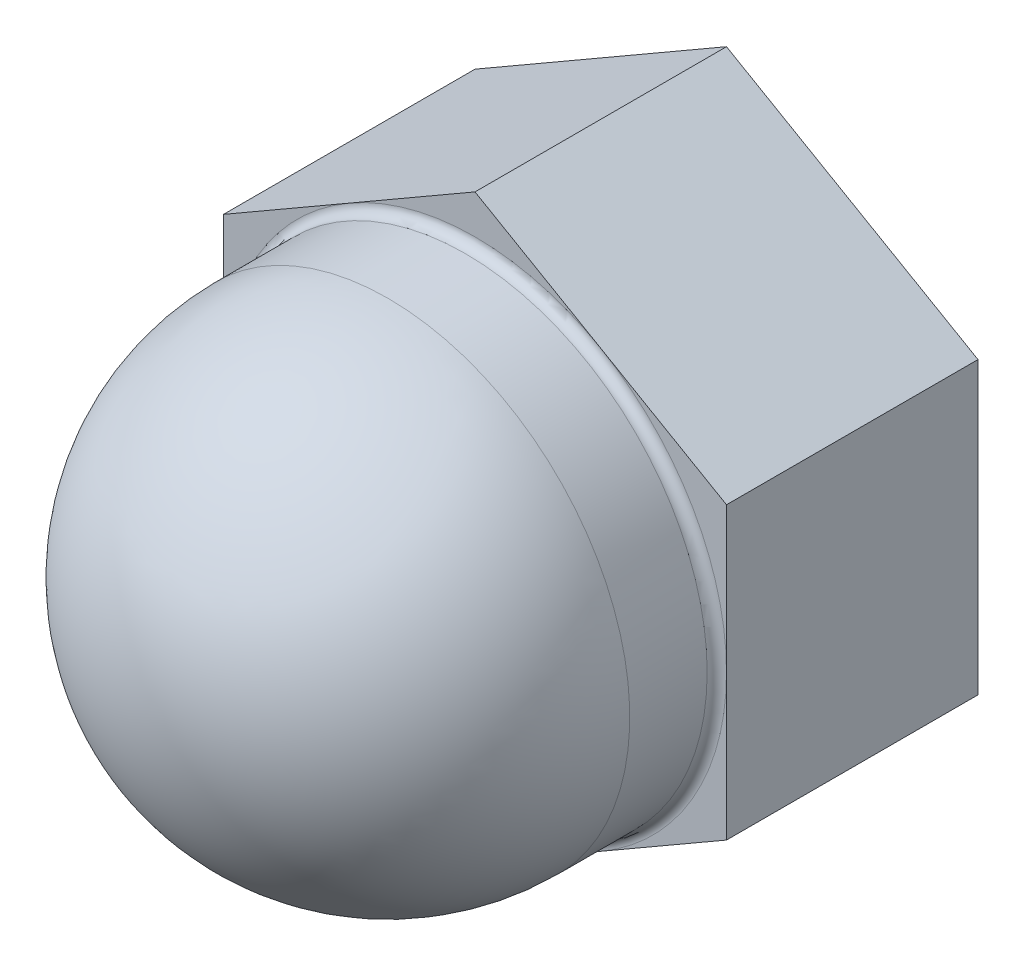
from build123d import *

# Parameters (mm, degrees)
EXTRUDE_1_DEPTH     = 3.25
FILLET_1_R          = 0.25
SKETCH_4_R          = 4
CUT_EXTRUDE_1_DEPTH = 10.65
THREAD_1_PITCH      = 1.25


with BuildPart() as part:
    # Эскиз2 → Бобышка-Вытянуть1 (new, symmetric)
    with BuildSketch(Plane.XY):
        Polygon((0, 7.505553499), (-6.5, 3.75277675), (-6.5, -3.75277675), (0, -7.505553499), (6.5, -3.75277675), (6.5, 3.75277675), align=None)
    extrude(amount=EXTRUDE_1_DEPTH, both=True)

    # Эскиз3 → Повернуть1 (revolve)
    with BuildSketch(Plane(origin=(0, 0, 0), x_dir=(0, 0, -1), z_dir=(1, 0, 0))):
        with BuildLine():
            Line((-3.25, 0), (-11.75, 0))
            ThreePointArc((-11.75, 0), (-9.919417382, 4.419417382), (-5.5, 6.25))
            Line((-5.5, 6.25), (-3.25, 6.25))
            Line((-3.25, 6.25), (-3.25, 0))
        make_face()
    revolve(axis=Axis((0, 0, 3.25), (0, 0, 1)))

    # Скругление1
    fillet_1_edges = [part.edges().sort_by_distance(p)[0] for p in [
        (0, -6.25, 3.25),
    ]]
    fillet(fillet_1_edges, radius=FILLET_1_R - 0.0001)  # a hair under: the kernel refuses the full size

    # Эскиз4 → Вырез-Вытянуть1 (cut)
    with BuildSketch(Plane(origin=(0, 0, -3.25), x_dir=(-1, 0, 0), z_dir=(0, 0, -1))):
        Circle(SKETCH_4_R)
    extrude(amount=-CUT_EXTRUDE_1_DEPTH, mode=Mode.SUBTRACT)

    # Резьба1: the profile of Профиль резьбы1 profile screwed along a right-hand helix of 8.52 turns, 8 arcs to a turn; built about Z, then put on its axis
    thread_1_z = Axis((0, 0, 0), (0, 0, 1))
    thread_1_corners = [(4.0003, 0, -0.000173205), (3.323417656, 0, 0.390624998), (3.323417656, 0, 0.546874998), (4.0003, 0, 0.937673202)]
    with BuildLine(mode=Mode.PRIVATE) as thread_1_profile:
        Line(thread_1_corners[0], thread_1_corners[1])
        Line(thread_1_corners[1], thread_1_corners[2])
        Line(thread_1_corners[2], thread_1_corners[3])
        Line(thread_1_corners[3], thread_1_corners[0])
    thread_1_cap = Face(thread_1_profile.wire())
    thread_1_turn_angles = [0, 22.5, 45, 67.5, 90, 112.5, 135, 157.5, 180, 202.5, 225, 247.5, 270, 292.5, 315, 337.5, 360]
    thread_1_turn_weights = [1, 0.9238795325112867, 1, 0.9238795325112867, 1, 0.9238795325112867, 1, 0.9238795325112867, 1, 0.9238795325112867, 1, 0.9238795325112867, 1, 0.9238795325112867, 1, 0.9238795325112867, 1]
    thread_1_turn_rails = [Edge.make_bspline([Vector(p[0], p[1], 0).rotate(thread_1_z, thread_1_turn_angles[k]) / thread_1_turn_weights[k] + Vector(0, 0, p[2] + THREAD_1_PITCH * thread_1_turn_angles[k] / 360) for k in range(17)], [0, 0, 0, 1, 1, 2, 2, 3, 3, 4, 4, 5, 5, 6, 6, 7, 7, 8, 8, 8], 2, thread_1_turn_weights) for p in thread_1_corners]
    thread_1_turn_sides = [Face.make_surface_from_curves(thread_1_turn_rails[p[0]], thread_1_turn_rails[p[1]]) for p in [(0, 1), (1, 2), (2, 3), (3, 0)]]
    thread_1_last_angles = [2880, 2902.5, 2925, 2947.5, 2970, 2992.5, 3015, 3037.5, 3060, 3063.6, 3067.2]
    thread_1_last_weights = [1, 0.9238795325112867, 1, 0.9238795325112867, 1, 0.9238795325112867, 1, 0.9238795325112867, 1, 0.9980267284282717, 1]
    thread_1_last_rails = [Edge.make_bspline([Vector(p[0], p[1], 0).rotate(thread_1_z, thread_1_last_angles[k]) / thread_1_last_weights[k] + Vector(0, 0, p[2] + THREAD_1_PITCH * thread_1_last_angles[k] / 360) for k in range(11)], [0, 0, 0, 1, 1, 2, 2, 3, 3, 4, 4, 5, 5, 5], 2, thread_1_last_weights) for p in thread_1_corners]
    thread_1_last_sides = [Face.make_surface_from_curves(thread_1_last_rails[p[0]], thread_1_last_rails[p[1]]) for p in [(0, 1), (1, 2), (2, 3), (3, 0)]]
    thread_1 = Plane(origin=(0, 0, -3.25), x_dir=(1, 0, 0), z_dir=(0, 0, 1)) * Solid(Shell([*[p.moved(Location((0, 0, THREAD_1_PITCH * i))) for i in range(8) for p in thread_1_turn_sides], *thread_1_last_sides, thread_1_cap, thread_1_cap.rotate(thread_1_z, 3067.2).moved(Location((0, 0, THREAD_1_PITCH * 3067.2 / 360)))]))
    add(thread_1)


solid = part.part
